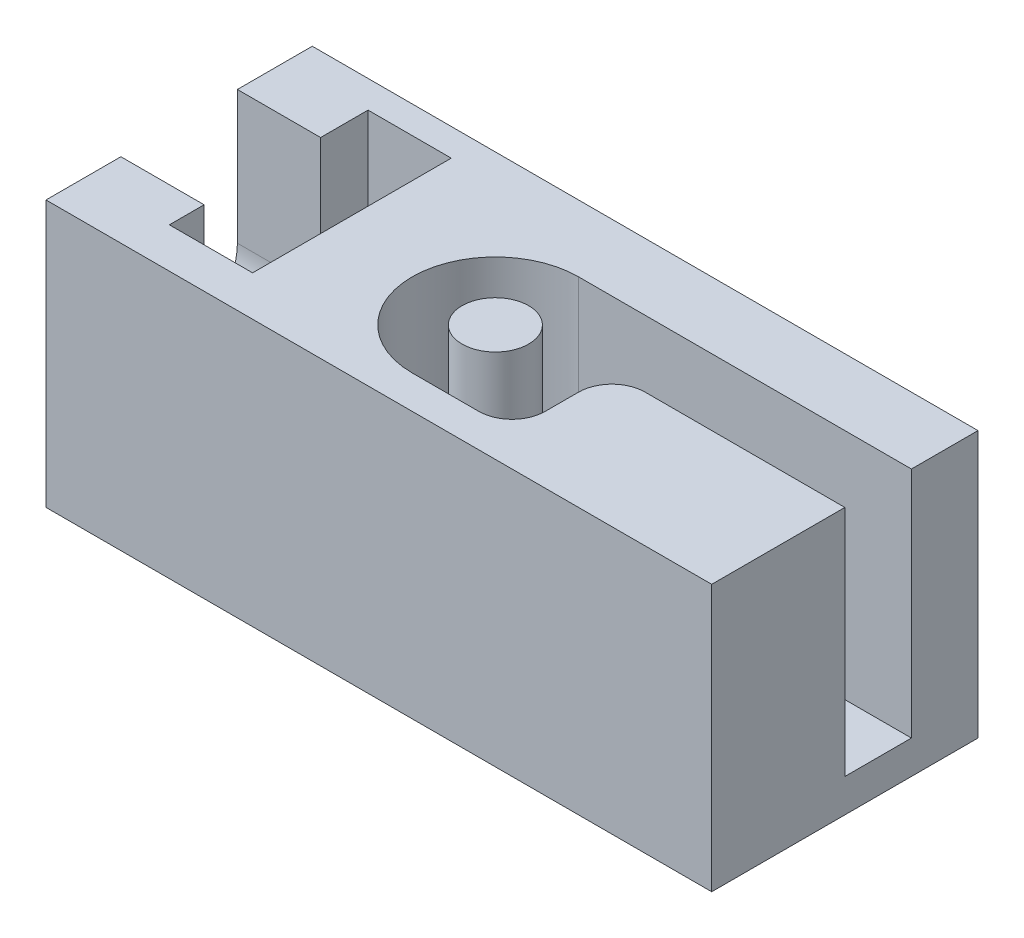
from build123d import *

# Parameters (mm, degrees)
SKETCH1_W           = 20
SKETCH1_H           = 8
BOSS_EXTRUDE1_DEPTH = 8
SKETCH2_R           = 1
CUT_EXTRUDE1_DEPTH  = 7
CUT_EXTRUDE2_DEPTH  = 5
CUT_EXTRUDE3_DEPTH  = 2.5


with BuildPart() as part:
    # Sketch1 → Boss-Extrude1 (new body)
    with BuildSketch(Plane(origin=(0, 0, 0), x_dir=(1, 0, 0), z_dir=(0, 1, 0))):
        with Locations((10, 4)):
            Rectangle(SKETCH1_W, SKETCH1_H)
    extrude(amount=BOSS_EXTRUDE1_DEPTH)

    # Sketch2 → Cut-Extrude1 (cut)
    with BuildSketch(Plane(origin=(0, 8, 0), x_dir=(1, 0, 0), z_dir=(0, 1, 0))):
        with BuildLine():
            Line((20, 6), (10, 6))
            ThreePointArc((10, 6), (7.5, 3.5), (10, 1))
            Line((10, 1), (12, 1))
            ThreePointArc((12, 1), (12.707106781, 1.292893219), (13, 2))
            Line((13, 2), (13, 3))
            ThreePointArc((13, 3), (13.292893219, 3.707106781), (14, 4))
            Line((14, 4), (20, 4))
            Line((20, 4), (20, 6))
        make_face()
        with Locations((10, 3.5)):
            Circle(SKETCH2_R, mode=Mode.SUBTRACT)
    extrude(amount=-CUT_EXTRUDE1_DEPTH, mode=Mode.SUBTRACT)

    # Sketch4 → Cut-Extrude2 (cut)
    with BuildSketch(Plane.ZY):
        with BuildLine():
            Line((-5.75, 4), (-5.75, 8))
            Line((-5.75, 8), (-2.25, 8))
            Line((-2.25, 8), (-2.25, 4))
            ThreePointArc((-2.25, 4), (-4, 2.25), (-5.75, 4))
        make_face()
    extrude(amount=-CUT_EXTRUDE2_DEPTH, mode=Mode.SUBTRACT)

    # Sketch5 → Cut-Extrude3 (cut)
    with BuildSketch(Plane.ZY.offset(-5)):
        Polygon((-7.175426481, 3.5), (-7.175426481, 14.06619177), (-1.206769201, 14.06619177), (-1.206769201, 3.638089636), (-1.953153528, 1.572294735), (-5.079031196, 1.013526325), align=None)
    extrude(amount=CUT_EXTRUDE3_DEPTH, mode=Mode.SUBTRACT)


solid = part.part
